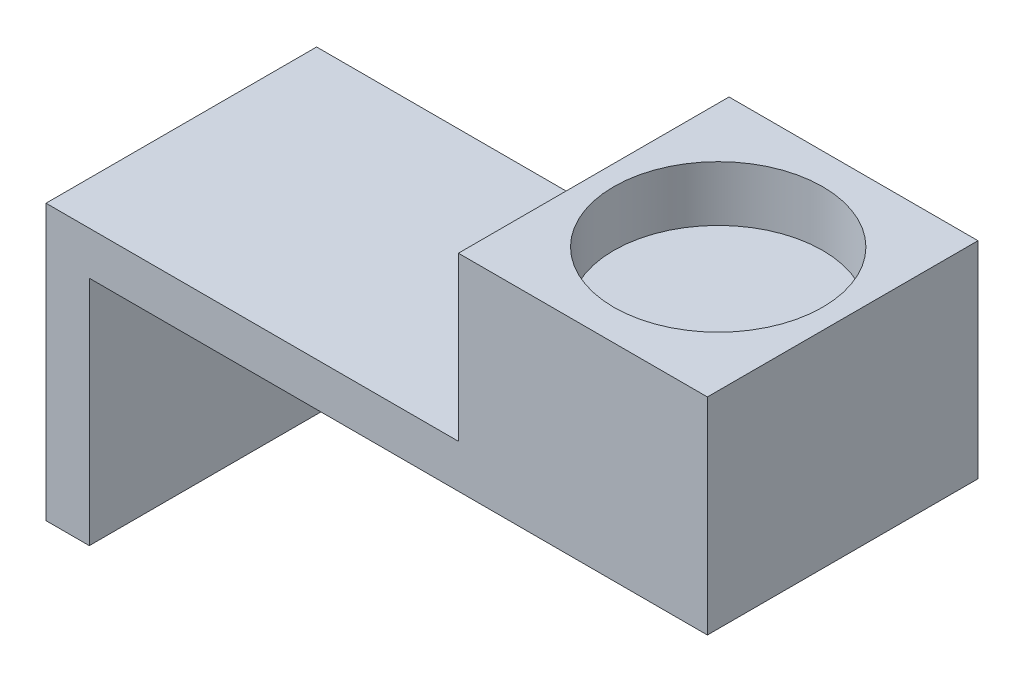
from build123d import *

# Parameters (mm, degrees)
SKETCH1_W           = 61.1
SKETCH1_H           = 25
BOSS_EXTRUDE1_DEPTH = 4
SKETCH5_W           = 25
SKETCH5_H           = 19.05
BOSS_EXTRUDE5_DEPTH = 23
SKETCH6_W           = 25
SKETCH6_H           = 25.4
BOSS_EXTRUDE6_DEPTH = 4
SKETCH9_R           = 9.65
CUT_EXTRUDE1_DEPTH  = 5.1


with BuildPart() as part:
    # Sketch1 → Boss-Extrude1 (new body)
    with BuildSketch(Plane(origin=(0, 0, 0), x_dir=(1, 0, 0), z_dir=(0, 1, 0))):
        with Locations((-30.55, 12.5)):
            Rectangle(SKETCH1_W, SKETCH1_H)
    extrude(amount=BOSS_EXTRUDE1_DEPTH)

    # Sketch5 → Boss-Extrude5 (add)
    with BuildSketch(Plane(origin=(0, 0, 0), x_dir=(0, 0, -1), z_dir=(1, 0, 0))):
        with Locations((12.5, 9.525)):
            Rectangle(SKETCH5_W, SKETCH5_H)
    extrude(amount=-BOSS_EXTRUDE5_DEPTH)

    # Sketch6 → Boss-Extrude6 (add)
    with BuildSketch(Plane.ZY.offset(61.1)):
        with Locations((-12.5, -8.7)):
            Rectangle(SKETCH6_W, SKETCH6_H)
    extrude(amount=-BOSS_EXTRUDE6_DEPTH)

    # Sketch9 → Cut-Extrude1 (cut)
    with BuildSketch(Plane(origin=(0, 19.05, 0), x_dir=(1, 0, 0), z_dir=(0, 1, 0))):
        with Locations((-11.5, 12.5)):
            Circle(SKETCH9_R)
    extrude(amount=-CUT_EXTRUDE1_DEPTH, mode=Mode.SUBTRACT)


solid = part.part
